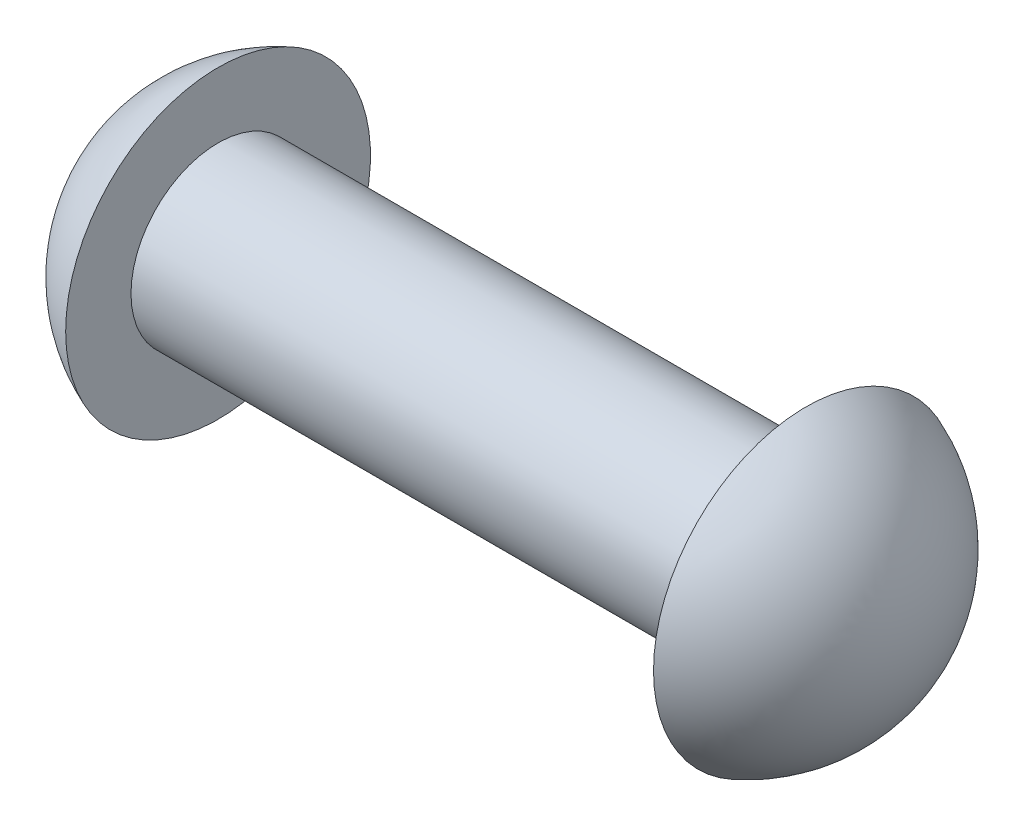
from build123d import *


with BuildPart() as part:
    # Sketch1 → Base-Revolve (revolve)
    with BuildSketch(Plane.XY):
        with BuildLine():
            Line((-31.8, 0), (0, 0))
            Line((0, 0), (0, 4))
            Line((0, 4), (-27, 4))
            Line((-27, 4), (-27, 7))
            ThreePointArc((-27, 7), (-30.485466933, 4.244320183), (-31.8, 0))
        make_face()
    revolve(axis=Axis((-39, 0, 0), (1, 0, 0)))

    # Sketch3 → HeadTypeA (revolve)
    with BuildSketch(Plane.XY):
        with BuildLine():
            Line((0, 0), (4.8, 0))
            ThreePointArc((4.8, 0), (3.485466933, 4.244320183), (0, 7))
            Line((0, 7), (0, 0))
        make_face()
    revolve(axis=Axis((-49, 0, 0), (1, 0, 0)))


solid = part.part
